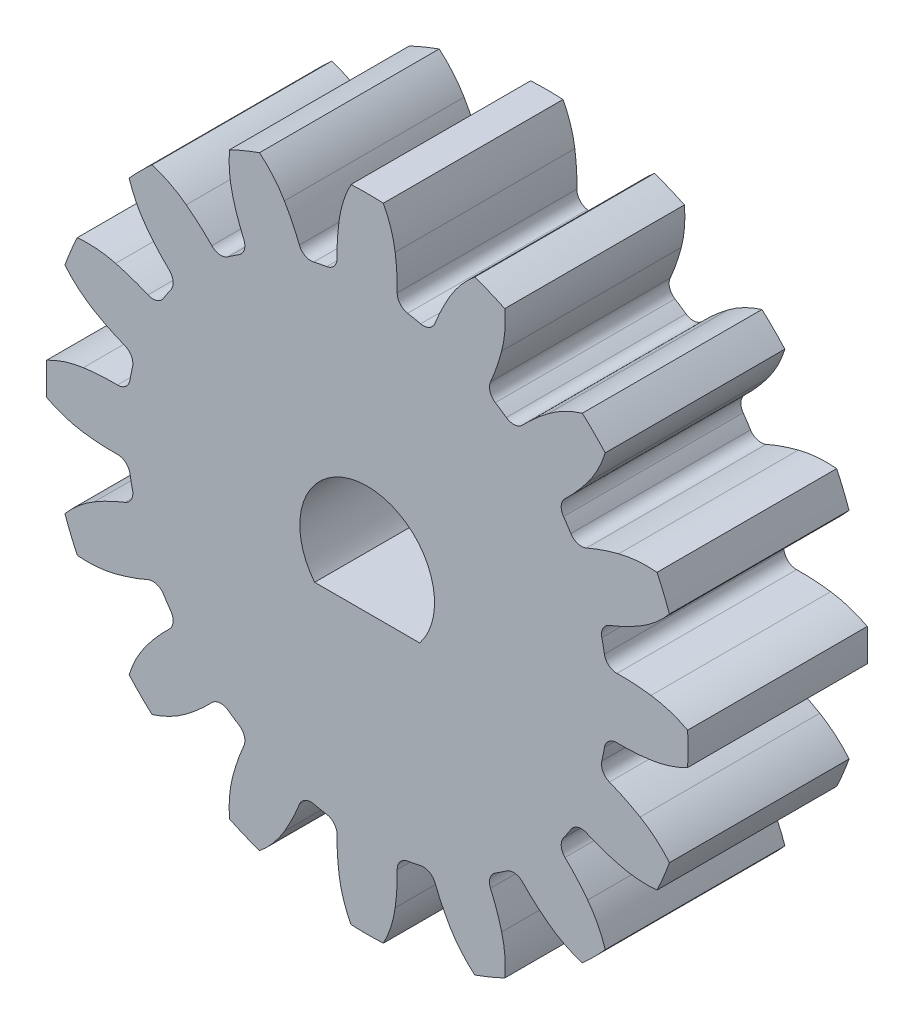
from build123d import *

# Parameters (mm, degrees)
SKETCH1_R                = 7.14375
BLANK_DISK_DEPTH         = 2.000000064
GEAR_TOOTH_CUT_DEPTH     = 11.865833109
GEAR_TEETH_REVOLVE_COUNT = 16
SKETCH4_R                = 0.75
HUB_EXTRUDE_DEPTH        = 0.635
HEX_BORE_CUT_DEPTH       = 11.865833109
HEX_BORE_CUT_DEPTH_BACK  = 11.865833109


with BuildPart() as part:
    # Sketch1 → BLANK DISK (new, symmetric)
    with BuildSketch(Plane.XY):
        Circle(SKETCH1_R)
    extrude(amount=BLANK_DISK_DEPTH, both=True)

    # Sketch2 → GEAR TOOTH CUT (cut, through all)
    with BuildSketch(Plane.XY.offset(2.000000064)):
        with BuildLine():
            ThreePointArc((-6.729578511, -2.397068443), (-7.006484847, -1.393676488), (-7.134638229, -0.36069573))
            ThreePointArc((-7.134638229, -0.36069573), (-6.738344867, -0.527361079), (-6.319316374, -0.623490625))
            ThreePointArc((-6.319316374, -0.623490625), (-5.941040224, -0.66126581), (-5.560959964, -0.668934311))
            ThreePointArc((-5.560959964, -0.668934311), (-5.378434987, -0.732653962), (-5.281676635, -0.900025949))
            ThreePointArc((-5.281676635, -0.900025949), (-5.254863635, -1.045257366), (-5.22405796, -1.18969459))
            ThreePointArc((-5.22405796, -1.18969459), (-5.249400534, -1.381353962), (-5.393647169, -1.510072528))
            ThreePointArc((-5.393647169, -1.510072528), (-5.741860935, -1.662607718), (-6.07688659, -1.842267453))
            ThreePointArc((-6.07688659, -1.842267453), (-6.427231253, -2.091434835), (-6.729578511, -2.397068443))
        make_face()
    gear_tooth_cut = extrude(amount=-GEAR_TOOTH_CUT_DEPTH, mode=Mode.SUBTRACT)

    # GEAR TEETH REVOLVE: GEAR TOOTH CUT ×16 about axis
    gear_teeth_revolve_axis = Axis((0, 0, 50), (0, 0, -1))
    for i in range(1, GEAR_TEETH_REVOLVE_COUNT):
        add(gear_tooth_cut.rotate(gear_teeth_revolve_axis, i * 360 / GEAR_TEETH_REVOLVE_COUNT), mode=Mode.SUBTRACT)

    # Sketch4 → Hub Extrude (add)
    with BuildSketch(Plane.XY.offset(2.000000064)):
        Circle(SKETCH4_R)
    extrude(amount=HUB_EXTRUDE_DEPTH)

    # Sketch3 → HEX BORE CUT (cut, two sides: drawn at the far end of the back side and taken through both)
    with BuildSketch(Plane.XY.offset(2.000000064).offset(-HEX_BORE_CUT_DEPTH_BACK)):
        with BuildLine():
            Line((-1.168931136, -0.94), (1.168931136, -0.94))
            ThreePointArc((1.168931136, -0.94), (0, 1.5), (-1.168931136, -0.94))
        make_face()
    extrude(amount=HEX_BORE_CUT_DEPTH + HEX_BORE_CUT_DEPTH_BACK, mode=Mode.SUBTRACT)


solid = part.part
